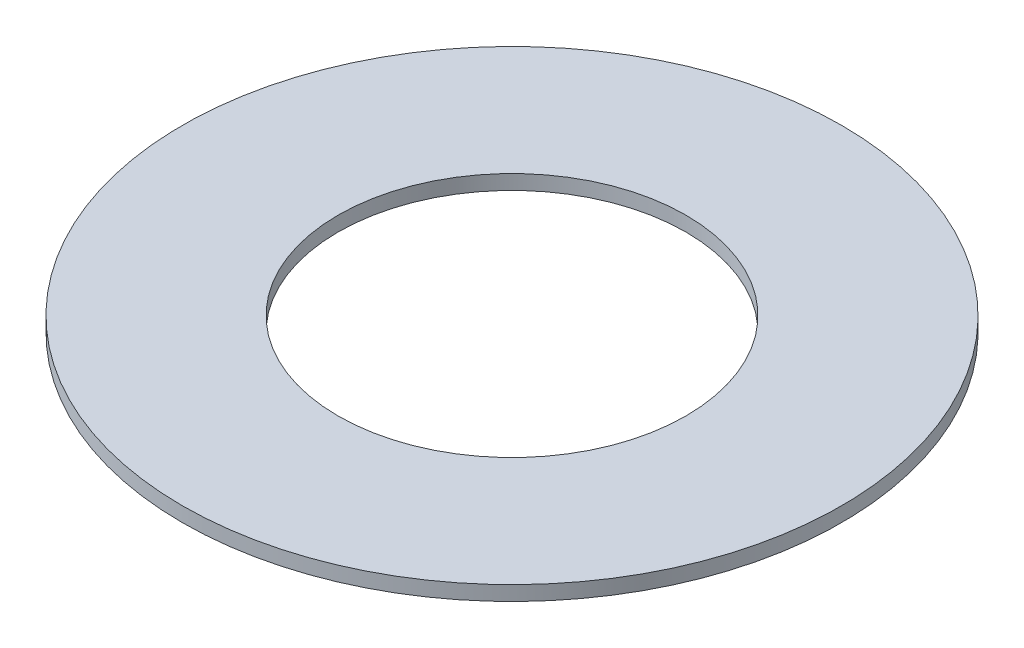
from build123d import *

# Parameters (mm, degrees)
SKETCH1_R           = 90
BOSS_EXTRUDE1_DEPTH = 4
SKETCH2_R           = 47.5
CUT_EXTRUDE1_DEPTH  = 128.342059038


with BuildPart() as part:
    # Sketch1 → Boss-Extrude1 (new body)
    with BuildSketch(Plane(origin=(0, 0, 0), x_dir=(1, 0, 0), z_dir=(0, 1, 0))):
        Circle(SKETCH1_R)
    extrude(amount=BOSS_EXTRUDE1_DEPTH)

    # Sketch2 → Cut-Extrude1 (cut, through all)
    with BuildSketch(Plane(origin=(0, 0, 0), x_dir=(1, 0, 0), z_dir=(0, 1, 0))):
        Circle(SKETCH2_R)
    extrude(amount=CUT_EXTRUDE1_DEPTH, mode=Mode.SUBTRACT)


solid = part.part
